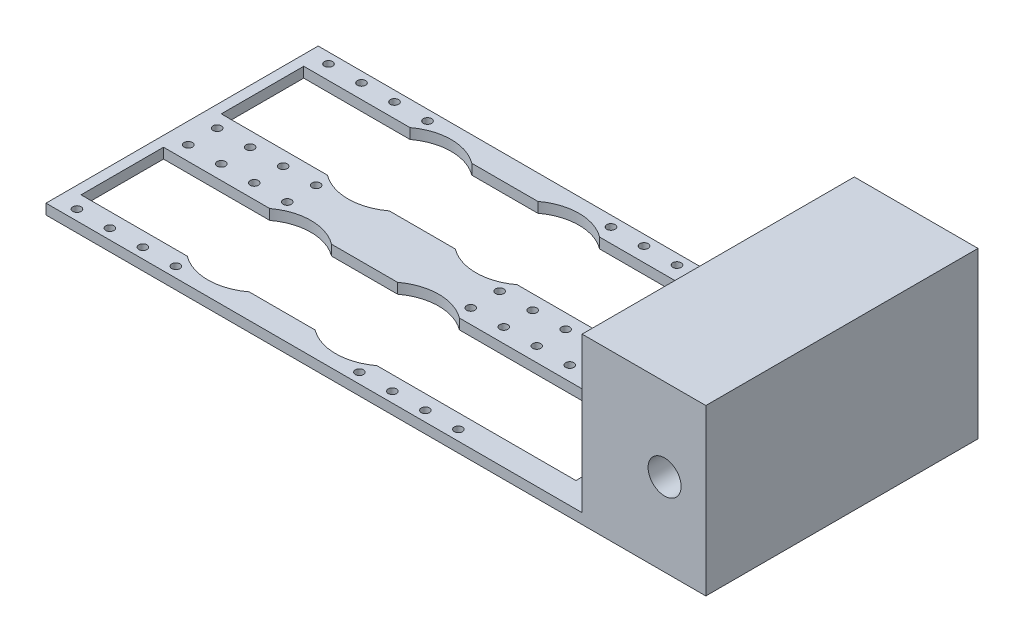
from build123d import *

# Parameters (mm, degrees)
SKETCH1_W           = 160
SKETCH1_H           = 66
BOSS_EXTRUDE1_DEPTH = 40
SKETCH2_R           = 4
SKETCH2_W           = 130
SKETCH2_H           = 37.5
CUT_EXTRUDE1_DEPTH  = 112.157545853
SKETCH3_R           = 1
SKETCH3_W           = 120
SKETCH3_H           = 20
CUT_EXTRUDE2_DEPTH  = 96.336247042
SKETCH4_R           = 12.5
CUT_EXTRUDE3_DEPTH  = 95.314633011


with BuildPart() as part:
    # Sketch1 → Boss-Extrude1 (new body)
    with BuildSketch(Plane(origin=(0, 0, 0), x_dir=(1, 0, 0), z_dir=(0, 1, 0))):
        Rectangle(SKETCH1_W, SKETCH1_H)
    extrude(amount=BOSS_EXTRUDE1_DEPTH)

    # Sketch2 → Cut-Extrude1 (cut, through all)
    with BuildSketch(Plane.XY.offset(33)):
        with Locations((70, 20)):
            Circle(SKETCH2_R)
        with Locations((-15, 21.25)):
            Rectangle(SKETCH2_W, SKETCH2_H)
    extrude(amount=-CUT_EXTRUDE1_DEPTH, mode=Mode.SUBTRACT)

    # Sketch3 → Cut-Extrude2 (cut, through all)
    with BuildSketch(Plane(origin=(0, 40, 0), x_dir=(1, 0, 0), z_dir=(0, 1, 0))):
        with Locations((-75, 30.5)):
            Circle(SKETCH3_R)
        with Locations((-75, 3.5)):
            Circle(SKETCH3_R)
        with Locations((-67, 30.5)):
            Circle(SKETCH3_R)
        with Locations((-59, 30.5)):
            Circle(SKETCH3_R)
        with Locations((-51, 30.5)):
            Circle(SKETCH3_R)
        with Locations((-67, 3.5)):
            Circle(SKETCH3_R)
        with Locations((-59, 3.5)):
            Circle(SKETCH3_R)
        with Locations((-51, 3.5)):
            Circle(SKETCH3_R)
        with Locations((-6.5, 30.5)):
            Circle(SKETCH3_R)
        with Locations((-6.5, 3.5)):
            Circle(SKETCH3_R)
        with Locations((1.5, 30.5)):
            Circle(SKETCH3_R)
        with Locations((9.5, 30.5)):
            Circle(SKETCH3_R)
        with Locations((17.5, 30.5)):
            Circle(SKETCH3_R)
        with Locations((1.5, 3.5)):
            Circle(SKETCH3_R)
        with Locations((9.5, 3.5)):
            Circle(SKETCH3_R)
        with Locations((17.5, 3.5)):
            Circle(SKETCH3_R)
        with Locations((17.5, -3.5)):
            Circle(SKETCH3_R)
        with Locations((9.5, -3.5)):
            Circle(SKETCH3_R)
        with Locations((1.5, -3.5)):
            Circle(SKETCH3_R)
        with Locations((17.5, -30.5)):
            Circle(SKETCH3_R)
        with Locations((9.5, -30.5)):
            Circle(SKETCH3_R)
        with Locations((1.5, -30.5)):
            Circle(SKETCH3_R)
        with Locations((-6.5, -3.5)):
            Circle(SKETCH3_R)
        with Locations((-6.5, -30.5)):
            Circle(SKETCH3_R)
        with Locations((-51, -3.5)):
            Circle(SKETCH3_R)
        with Locations((-59, -3.5)):
            Circle(SKETCH3_R)
        with Locations((-67, -3.5)):
            Circle(SKETCH3_R)
        with Locations((-51, -30.5)):
            Circle(SKETCH3_R)
        with Locations((-59, -30.5)):
            Circle(SKETCH3_R)
        with Locations((-67, -30.5)):
            Circle(SKETCH3_R)
        with Locations((-75, -3.5)):
            Circle(SKETCH3_R)
        with Locations((-75, -30.5)):
            Circle(SKETCH3_R)
        with Locations((-17.5, 17)):
            Rectangle(SKETCH3_W, SKETCH3_H)
        with Locations((-17.5, -17)):
            Rectangle(SKETCH3_W, SKETCH3_H)
    extrude(amount=-CUT_EXTRUDE2_DEPTH, mode=Mode.SUBTRACT)

    # Sketch4 → Cut-Extrude3 (cut, through all)
    with BuildSketch(Plane(origin=(0, 2.5, 0), x_dir=(1, 0, 0), z_dir=(0, 1, 0))):
        with Locations((-44.25, -17)):
            Circle(SKETCH4_R)
        with Locations((-44.25, 17)):
            Circle(SKETCH4_R)
        with Locations((-13.25, 17)):
            Circle(SKETCH4_R)
        with Locations((-13.25, -17)):
            Circle(SKETCH4_R)
    extrude(amount=-CUT_EXTRUDE3_DEPTH, mode=Mode.SUBTRACT)


solid = part.part
